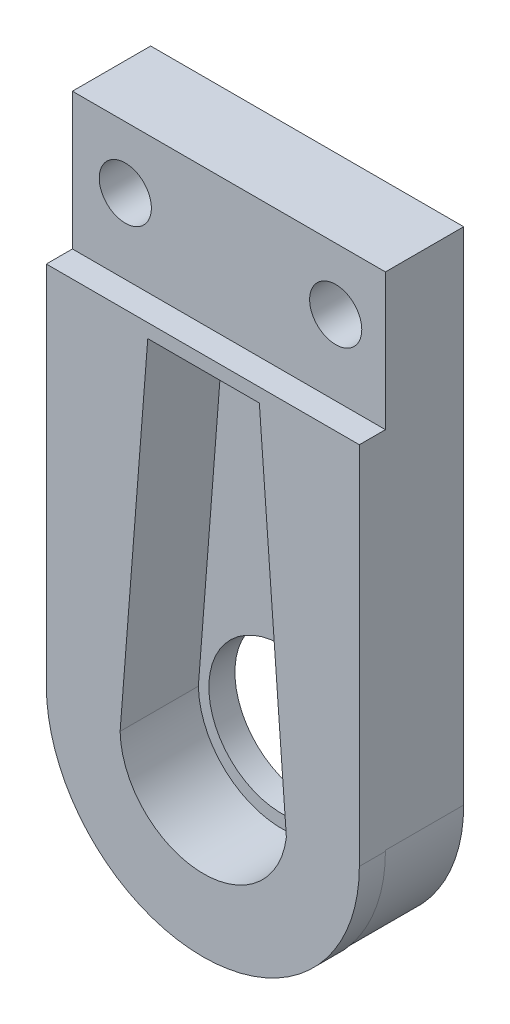
from build123d import *

# Parameters (mm, degrees)
SKETCH1_W           = 12
SKETCH1_H           = 25.2
BOSS_EXTRUDE1_DEPTH = 3
FILLET1_R           = 6
SKETCH3_W           = 12
SKETCH3_H           = 20
BOSS_EXTRUDE2_DEPTH = 1
FILLET2_R           = 6
CUT_EXTRUDE1_DEPTH  = 3
SKETCH5_R           = 2.8
CUT_EXTRUDE2_DEPTH  = 126.573231257
SKETCH6_R           = 1
CUT_EXTRUDE3_DEPTH  = 126.573231257


with BuildPart() as part:
    # Sketch1 → Boss-Extrude1 (new body)
    with BuildSketch(Plane.XY.offset(5)):
        with Locations((-54.027704131, 97.655662644)):
            Rectangle(SKETCH1_W, SKETCH1_H)
    extrude(amount=BOSS_EXTRUDE1_DEPTH)

    # Fillet1
    fillet1_edges = [part.edges().sort_by_distance(p)[0] for p in [
        (-48.027704131, 85.055662644, 6.5),
        (-60.027704131, 85.055662644, 6.5),
    ]]
    fillet(fillet1_edges, radius=FILLET1_R - 0.0001)  # a hair under: the kernel refuses the full size

    # Sketch3 → Boss-Extrude2 (add)
    with BuildSketch(Plane.XY.offset(8)):
        with Locations((-54.027704131, 95.017998247)):
            Rectangle(SKETCH3_W, SKETCH3_H)
    extrude(amount=BOSS_EXTRUDE2_DEPTH)

    # Fillet2
    fillet2_edges = [part.edges().sort_by_distance(p)[0] for p in [
        (-48.027704131, 85.017998247, 8.5),
        (-60.027704131, 85.017998247, 8.5),
    ]]
    fillet(fillet2_edges, radius=FILLET2_R - 0.0001)  # a hair under: the kernel refuses the full size

    # Sketch4 → Cut-Extrude1 (cut, symmetric)
    with BuildSketch(Plane.XY.offset(9)):
        with BuildLine():
            Line((-56.13842392, 104.48600769), (-51.86157608, 104.48600769))
            Line((-51.86157608, 104.48600769), (-50.824897766, 90.586959839))
            ThreePointArc((-50.824897766, 90.586959839), (-54.164460237, 87.789583498), (-57.199226379, 90.914993286))
            Line((-57.199226379, 90.914993286), (-56.13842392, 104.48600769))
        make_face()
    extrude(amount=CUT_EXTRUDE1_DEPTH, both=True, mode=Mode.SUBTRACT)

    # Sketch5 → Cut-Extrude2 (cut, through all)
    with BuildSketch(Plane.XY.offset(6)):
        with Locations((-53.997448325, 91.08203191)):
            Circle(SKETCH5_R)
    extrude(amount=-CUT_EXTRUDE2_DEPTH, mode=Mode.SUBTRACT)

    # Sketch6 → Cut-Extrude3 (cut, through all)
    with BuildSketch(Plane.XY.offset(8)):
        with Locations((-57.999885247, 107.886757068)):
            Circle(SKETCH6_R)
        with Locations((-49.934118523, 107.886757068)):
            Circle(SKETCH6_R)
    extrude(amount=-CUT_EXTRUDE3_DEPTH, mode=Mode.SUBTRACT)


solid = part.part
